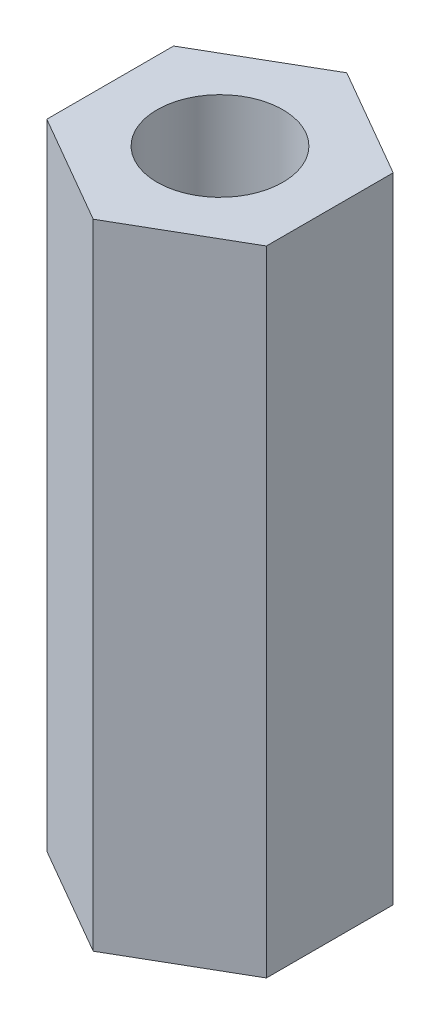
from build123d import *

# Parameters (mm, degrees)
SKETCH2_R           = 7.9375
BOSS_EXTRUDE1_DEPTH = 80


with BuildPart() as part:
    # Sketch2 → Boss-Extrude1 (new body)
    with BuildSketch(Plane(origin=(0, 0, 0), x_dir=(1, 0, 0), z_dir=(0, 1, 0))):
        Polygon((0, 16), (-13.856406461, 8), (-13.856406461, -8), (0, -16), (13.856406461, -8), (13.856406461, 8), align=None)
        Circle(SKETCH2_R, mode=Mode.SUBTRACT)
    extrude(amount=BOSS_EXTRUDE1_DEPTH)


solid = part.part
